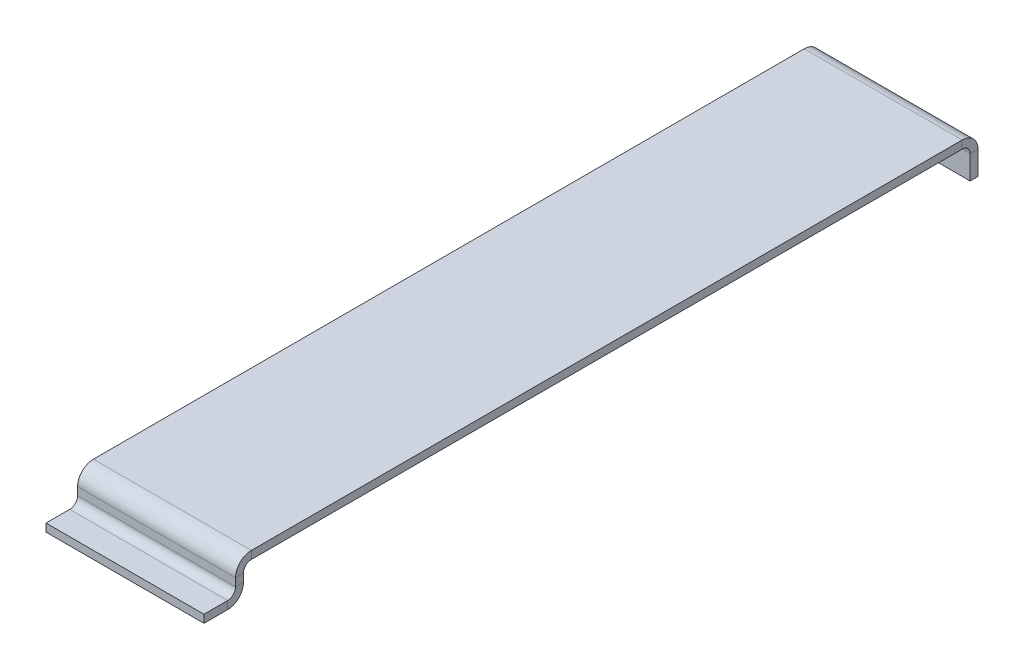
from build123d import *

# Parameters (mm, degrees)
ESBO_O1_W                      = 40
ESBO_O1_H                      = 180
FLANGE_BASE1_DEPTH             = 2
ARESTA_FLANGE1_DEPTH           = 40
ARESTA_FLANGE1_BEND_DEPTH      = 40
ARESTA_FLANGE4_STRIP_W         = 12
ARESTA_FLANGE4_STRIP_H         = 2
ARESTA_FLANGE4_STRIP_CUT_DEPTH = 40
ARESTA_FLANGE4_DEPTH           = 40


# Sheet-metal steps are written as plain solids
with BuildPart() as part:
    # Esboço1 → Flange-base1 (new body)
    with BuildSketch(Plane(origin=(0, 0, 0), x_dir=(1, 0, 0), z_dir=(0, 1, 0))):
        Rectangle(ESBO_O1_W, ESBO_O1_H)
    extrude(amount=-FLANGE_BASE1_DEPTH)

    # Aresta-Flange1 section (across the edge) → Aresta-Flange1 (add)
    with BuildSketch(Plane(origin=(20, -2, 92), x_dir=(0, 0, -1), z_dir=(-1, 0, 0))):
        with BuildLine():
            Line((-2, 2), (-2, 8))
            Line((-2, 8), (0, 8))
            Line((0, 8), (0, 2))
            ThreePointArc((0, 2), (0.585786438, 0.585786438), (2, 0))
            Line((2, 0), (2, -2))
            ThreePointArc((2, -2), (-0.828427125, -0.828427125), (-2, 2))
        make_face()
    extrude(amount=ARESTA_FLANGE1_DEPTH)

    # Aresta-Flange1 section 2 (across the edge) → Aresta-Flange1 bend (add)
    with BuildSketch(Plane(origin=(-20, -2, -92), x_dir=(0, 0, 1), z_dir=(1, 0, 0))):
        with BuildLine():
            Line((-2, 2), (-2, 8))
            Line((-2, 8), (0, 8))
            Line((0, 8), (0, 2))
            ThreePointArc((0, 2), (0.585786438, 0.585786438), (2, 0))
            Line((2, 0), (2, -2))
            ThreePointArc((2, -2), (-0.828427125, -0.828427125), (-2, 2))
        make_face()
    extrude(amount=ARESTA_FLANGE1_BEND_DEPTH)

    # Aresta-Flange4 strip (across the edge) → Aresta-Flange4 strip cut (cut)
    with BuildSketch(Plane(origin=(-20, -10, 94), x_dir=(0, 1, 0), z_dir=(1, 0, 0))):
        with Locations((-2, -1)):
            Rectangle(ARESTA_FLANGE4_STRIP_W, ARESTA_FLANGE4_STRIP_H)
    extrude(amount=ARESTA_FLANGE4_STRIP_CUT_DEPTH, mode=Mode.SUBTRACT)

    # Aresta-Flange4 section (across the edge) → Aresta-Flange4 (add)
    with BuildSketch(Plane(origin=(-20, -10, 94), x_dir=(0, 1, 0), z_dir=(1, 0, 0))):
        with BuildLine():
            Line((0, 2), (0, 8))
            Line((0, 8), (2, 8))
            Line((2, 8), (2, 2))
            ThreePointArc((2, 2), (2.585786438, 0.585786438), (4, 0))
            Line((4, 0), (4, -2))
            ThreePointArc((4, -2), (1.171572875, -0.828427125), (0, 2))
        make_face()
    extrude(amount=ARESTA_FLANGE4_DEPTH)


solid = part.part
